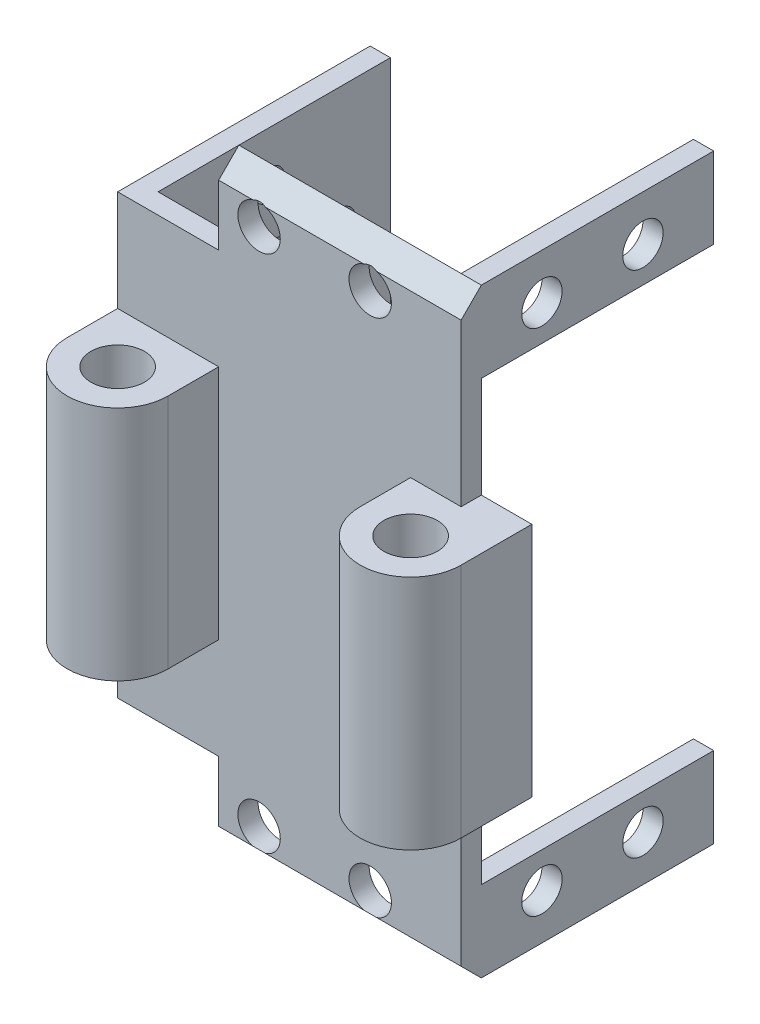
from build123d import *

# Parameters (mm, degrees)
BOSS_EXTRU_1_DEPTH      = 2
ESQUISSE2_W             = 2
ESQUISSE2_H             = 43.4
BOSS_EXTRU_2_DEPTH      = 23
ESQUISSE3_W             = 2
ESQUISSE3_H             = 23
BOSS_EXTRU_3_DEPTH      = 8
ESQUISSE8_W             = 2
ESQUISSE8_H             = 23
BOSS_EXTRU_5_DEPTH      = 8
ESQUISSE9_R             = 2
ENL_V_MAT_EXTRU_3_DEPTH = 2
ESQUISSE10_R            = 1.5
ESQUISSE10_R_2          = 2.25
ENL_V_MAT_EXTRU_4_DEPTH = 2
ENL_V_MAT_EXTRU_5_REACH = 47.66
ESQUISSE11_R            = 2.1
ESQUISSE13_R            = 2.65
BOSS_EXTRU_6_DEPTH      = 43.4
ENL_V_MAT_EXTRU_6_DEPTH = 10
ENL_V_MAT_EXTRU_7_DEPTH = 10
CHANFREIN1_SIZE         = 2
CHANFREIN2_SIZE         = 2


with BuildPart() as part:
    # Esquisse1 → Boss.-Extru.1 (new body)
    with BuildSketch(Plane.XY):
        Polygon((8.75, 17), (8.75, 19), (13.75, 19), (13.75, 27), (-10.25, 27), (-10.25, 19), (-20.25, 19), (-20.25, -24.4), (-10.25, -24.4), (-10.25, -32.4), (13.75, -32.4), (13.75, -24.4), (8.75, -24.4), (8.75, -22.4), (16.25, -22.4), (16.25, 17), align=None)
    extrude(amount=BOSS_EXTRU_1_DEPTH)

    # Esquisse2 → Boss.-Extru.2 (add)
    with BuildSketch(Plane(origin=(0, 0, 0), x_dir=(-1, 0, 0), z_dir=(0, 0, -1))):
        with Locations((19.25, -2.7)):
            Rectangle(ESQUISSE2_W, ESQUISSE2_H)
    extrude(amount=BOSS_EXTRU_2_DEPTH)

    # Esquisse3 → Boss.-Extru.3 (add)
    with BuildSketch(Plane(origin=(0, 27, 0), x_dir=(1, 0, 0), z_dir=(0, 1, 0))):
        with Locations((12.75, 11.5)):
            Rectangle(ESQUISSE3_W, ESQUISSE3_H)
    extrude(amount=-BOSS_EXTRU_3_DEPTH)

    # Esquisse8 → Boss.-Extru.5 (add)
    with BuildSketch(Plane.XZ.offset(32.4)):
        with Locations((12.75, -11.5)):
            Rectangle(ESQUISSE8_W, ESQUISSE8_H)
    extrude(amount=-BOSS_EXTRU_5_DEPTH)

    # Esquisse9 → Enlèv. mat.-Extru.3 (cut)
    with BuildSketch(Plane(origin=(13.75, 0, 0), x_dir=(0, 0, -1), z_dir=(1, 0, 0))):
        with Locations((6, 22.5)):
            Circle(ESQUISSE9_R)
        with Locations((16, 22.5)):
            Circle(ESQUISSE9_R)
        with Locations(Location((16, -27.9, 0), (0, 0, 180))):
            Circle(ESQUISSE9_R)
        with Locations(Location((6, -27.9, 0), (0, 0, 180))):
            Circle(ESQUISSE9_R)
    extrude(amount=-ENL_V_MAT_EXTRU_3_DEPTH, mode=Mode.SUBTRACT)

    # Esquisse10 → Enlèv. mat.-Extru.4 (cut)
    with BuildSketch(Plane.ZY.offset(20.25)):
        with Locations((-11, 14.1)):
            Circle(ESQUISSE10_R)
        with Locations((-11, 7.1)):
            Circle(ESQUISSE10_R_2)
        with Locations((-4, 7.1)):
            Circle(ESQUISSE10_R)
        with Locations((-11, 0.1)):
            Circle(ESQUISSE10_R)
        with Locations((-18, 7.1)):
            Circle(ESQUISSE10_R)
        with Locations(Location((-11, -5.5, 0), (0, 0, 180))):
            Circle(ESQUISSE10_R)
        with Locations(Location((-11, -12.5, 0), (0, 0, 180))):
            Circle(ESQUISSE10_R_2)
        with Locations(Location((-4, -12.5, 0), (0, 0, 180))):
            Circle(ESQUISSE10_R)
        with Locations(Location((-18, -12.5, 0), (0, 0, 180))):
            Circle(ESQUISSE10_R)
        with Locations(Location((-11, -19.5, 0), (0, 0, 180))):
            Circle(ESQUISSE10_R)
    extrude(amount=-ENL_V_MAT_EXTRU_4_DEPTH, mode=Mode.SUBTRACT)

    # Esquisse11 → Enlèv. mat.-Extru.5 (cut, up to next)
    with BuildSketch(Plane.XY.offset(2), mode=Mode.PRIVATE) as enl_v_mat_extru_5_sk1:
        with Locations((-6.25, 23)):
            Circle(ESQUISSE11_R)
    enl_v_mat_extru_5_tool1 = extrude(enl_v_mat_extru_5_sk1.sketch, amount=-ENL_V_MAT_EXTRU_5_REACH, mode=Mode.PRIVATE) & part.part
    # Esquisse11 → Enlèv. mat.-Extru.5 (cut, up to next)
    with BuildSketch(Plane.XY.offset(2), mode=Mode.PRIVATE) as enl_v_mat_extru_5_sk2:
        with Locations((4.75, 23)):
            Circle(ESQUISSE11_R)
    enl_v_mat_extru_5_tool2 = extrude(enl_v_mat_extru_5_sk2.sketch, amount=-ENL_V_MAT_EXTRU_5_REACH, mode=Mode.PRIVATE) & part.part
    # Esquisse11 → Enlèv. mat.-Extru.5 (cut, up to next)
    with BuildSketch(Plane.XY.offset(2), mode=Mode.PRIVATE) as enl_v_mat_extru_5_sk3:
        with Locations((4.75, -28.4)):
            Circle(ESQUISSE11_R)
    enl_v_mat_extru_5_tool3 = extrude(enl_v_mat_extru_5_sk3.sketch, amount=-ENL_V_MAT_EXTRU_5_REACH, mode=Mode.PRIVATE) & part.part
    # Esquisse11 → Enlèv. mat.-Extru.5 (cut, up to next)
    with BuildSketch(Plane.XY.offset(2), mode=Mode.PRIVATE) as enl_v_mat_extru_5_sk4:
        with Locations((-6.25, -28.4)):
            Circle(ESQUISSE11_R)
    enl_v_mat_extru_5_tool4 = extrude(enl_v_mat_extru_5_sk4.sketch, amount=-ENL_V_MAT_EXTRU_5_REACH, mode=Mode.PRIVATE) & part.part
    add(enl_v_mat_extru_5_tool1.solids().sort_by_distance((-6.25, 23, 2))[0], mode=Mode.SUBTRACT)
    add(enl_v_mat_extru_5_tool2.solids().sort_by_distance((4.75, 23, 2))[0], mode=Mode.SUBTRACT)
    add(enl_v_mat_extru_5_tool3.solids().sort_by_distance((4.75, -28.4, 2))[0], mode=Mode.SUBTRACT)
    add(enl_v_mat_extru_5_tool4.solids().sort_by_distance((-6.25, -28.4, 2))[0], mode=Mode.SUBTRACT)

    # Esquisse13 → Boss.-Extru.6 (add)
    # profile 1 of 2: a face of its own
    with BuildSketch(Plane.XZ.offset(24.4)):
        with BuildLine():
            Line((-10.25, 0), (-20.25, 0))
            Line((-20.25, 0), (-20.25, 7))
            ThreePointArc((-20.25, 7), (-15.25, 12), (-10.25, 7))
            Line((-10.25, 7), (-10.25, 0))
        make_face()
        with Locations(Location((-15.25, 7, 0), (0, 0, 270))):
            Circle(ESQUISSE13_R, mode=Mode.SUBTRACT)
    # profile 2 of 2: a face of its own
    with BuildSketch(Plane.XZ.offset(24.4)):
        with BuildLine():
            Line((8.75, 0), (18.75, 0))
            Line((18.75, 0), (18.75, 7))
            ThreePointArc((18.75, 7), (13.75, 12), (8.75, 7))
            Line((8.75, 7), (8.75, 0))
        make_face()
        with Locations(Location((13.75, 7, 0), (0, 0, 270))):
            Circle(ESQUISSE13_R, mode=Mode.SUBTRACT)
    extrude(amount=-BOSS_EXTRU_6_DEPTH)

    # Esquisse14 → Enlèv. mat.-Extru.6 (cut)
    with BuildSketch(Plane(origin=(0, 19, 0), x_dir=(1, 0, 0), z_dir=(0, 1, 0))):
        Polygon((-10.25, -2), (-20.25, -2), (-20.25, 7.294749089), (-22.778908198, 7.294749089), (-22.778908198, -2), (-24.693194377, -2), (-24.693194377, -14.280851393), (-10.25, -14.280851393), align=None)
        Polygon((8.75, -2), (13.75, -2), (13.75, 5.181058099), (21.169912006, 5.181058099), (21.169912006, -2), (27.112175355, -2), (27.112175355, -13.044541568), (8.75, -13.044541568), align=None)
    extrude(amount=-ENL_V_MAT_EXTRU_6_DEPTH, mode=Mode.SUBTRACT)

    # Esquisse15 → Enlèv. mat.-Extru.7 (cut)
    with BuildSketch(Plane.XZ.offset(24.4)):
        Polygon((-7.765139989, 2), (-20.25, 2), (-20.25, -7.221906492), (-27.573956422, -7.221906492), (-27.573956422, 2), (-33.179445784, 2), (-33.179445784, 15.314448699), (-7.765139989, 15.314448699), align=None)
        Polygon((6.630968462, 2), (13.75, 2), (13.75, -6.0207302), (22.303459128, -6.0207302), (22.303459128, 2), (24.534215098, 2), (24.534215098, 15.314448699), (6.630968462, 15.314448699), align=None)
    extrude(amount=-ENL_V_MAT_EXTRU_7_DEPTH, mode=Mode.SUBTRACT)

    # Chanfrein1
    # the kernel refuses this chamfer: 2 mm, written as the material it takes off along each edge
    with BuildSketch(Plane(origin=(18.893365976, 27, 2), x_dir=(0, -0.9996219169112968, 0.027495876610586296), z_dir=(-1, 0, 0))) as chanfrein1_piece_1:
        Polygon((CHANFREIN1_SIZE * 0.999621916911, -CHANFREIN1_SIZE * 0.0274958766106), (-CHANFREIN1_SIZE * 0.0274958766106, -CHANFREIN1_SIZE * 0.999621916911), (0, 0), align=None)
    extrude(amount=34.286731952, mode=Mode.SUBTRACT)

    # Chanfrein2
    # the kernel refuses this chamfer: 2 mm, written as the material it takes off along each edge
    with BuildSketch(Plane(origin=(-15.393365976, -32.4, 2), x_dir=(0, -0.02749587661058563, -0.9996219169112968), z_dir=(1, 0, 0))) as chanfrein2_piece_1:
        Polygon((CHANFREIN2_SIZE * 0.999621916911, CHANFREIN2_SIZE * 0.0274958766106), (-CHANFREIN2_SIZE * 0.0274958766106, CHANFREIN2_SIZE * 0.999621916911), (0, 0), align=None)
    extrude(amount=34.286731952, mode=Mode.SUBTRACT)


solid = part.part
